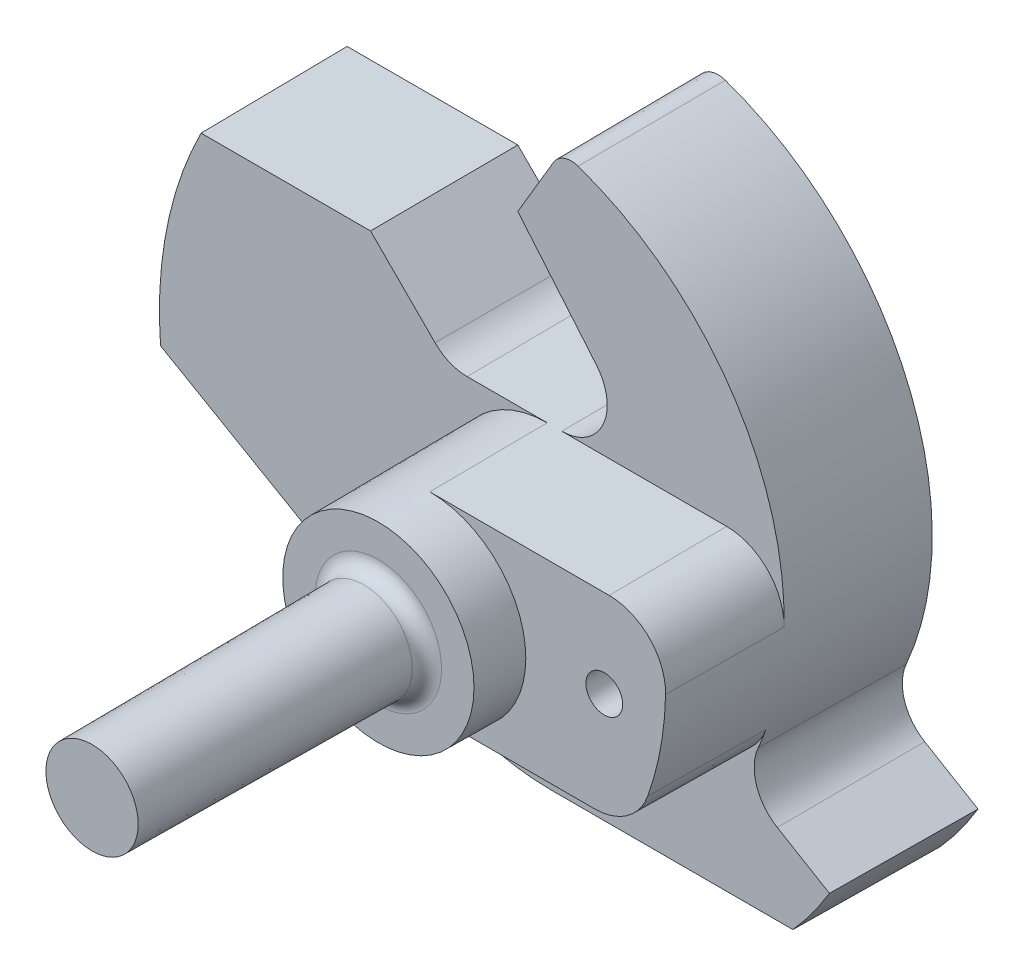
from build123d import *

# Parameters (mm, degrees)
EXTRUDE1_DEPTH      = 2.54
SKETCH2_R           = 1.7018
EXTRUDE2_DEPTH      = 2.921
EXTRUDE5_DEPTH      = 2.032
SKETCH3_R           = 0.889
EXTRUDE3_DEPTH      = 4.953
EXTRUDE4_DEPTH      = 4.819904
CIRPATTERN1_COUNT   = 8
EXTRUDE13_DEPTH     = 4.819904
SKETCH7_R           = 0.3175
EXTRUDE6_DEPTH      = 11.651707
EXTRUDE10_DEPTH     = 2.54
EXTRUDE12_DEPTH     = 1.27
DRAFT5_ANGLE        = 1
DRAFT6_ANGLE        = 1
DRAFT7_ANGLE        = -0.5
FILLET1_R           = 0.254
CHAMFER1_SIZE       = 0.381
CHAMFER1_SIZE2      = 0.659911
EXTRUDE14_DEPTH     = 0.6604
BOSS_EXTRUDE1_DEPTH = 4.159504
CUT_EXTRUDE1_DEPTH  = 1.5
CHAMFER3_SIZE       = 0.1016
CHAMFER4_SIZE       = 0.3048


with BuildPart() as part:
    # Sketch1 → Extrude1 (new body)
    with BuildSketch(Plane.XY):
        with BuildLine():
            Line((-1.924985, 1.924985), (-3.048, 3.048))
            Line((-3.048, 3.048), (-6.001338, 3.048))
            ThreePointArc((-6.001338, 3.048), (-6.602226, 1.310331), (-6.710486, -0.525108))
            Line((-6.710486, -0.525108), (-1.963941, -3.265527))
            ThreePointArc((-1.963941, -3.265527), (-0.983782, -3.671523), (0.068059, -3.81))
            Line((0.068059, -3.81), (4.259709, -3.81))
            ThreePointArc((4.259709, -3.81), (4.60741, -3.381272), (4.912126, -2.921))
            Line((4.912126, -2.921), (3.99071, -2.373079))
            ThreePointArc((3.99071, -2.373079), (3.640517, -1.933065), (3.66974, -1.371466))
            ThreePointArc((3.66974, -1.371466), (3.67694, 2.904446), (0.541494, 5.811758))
            ThreePointArc((0.541494, 5.811758), (0.285086, 5.809719), (0.088038, 5.645641))
            Line((0.088038, 5.645641), (-0.535349, 4.589543))
            Line((-0.535349, 4.589543), (0.837366, 2.953604))
            ThreePointArc((0.837366, 2.953604), (0.944247, 2.141765), (0.25364, 1.7018))
            Line((0.25364, 1.7018), (-1.386169, 1.7018))
            ThreePointArc((-1.386169, 1.7018), (-1.677774, 1.759804), (-1.924985, 1.924985))
        make_face()
    extrude(amount=EXTRUDE1_DEPTH)

    # Sketch2 → Extrude2 (add)
    with BuildSketch(Plane.XY.offset(2.54)):
        with Locations(Location((0, 0, 0), (0, 0, 90))):
            Circle(SKETCH2_R)
    extrude(amount=EXTRUDE2_DEPTH)

    # Sketch6 → Extrude5 (add)
    with BuildSketch(Plane.XY.offset(2.54)):
        with BuildLine():
            Line((0, 1.7018), (3.103645, 1.7018))
            ThreePointArc((3.103645, 1.7018), (3.829425, 1.396785), (4.119429, 0.664878))
            ThreePointArc((4.119429, 0.664878), (4.031669, -0.195019), (3.806175, -1.029451))
            ThreePointArc((3.806175, -1.029451), (3.434483, -1.516885), (2.850058, -1.7018))
            Line((2.850058, -1.7018), (0, -1.7018))
            ThreePointArc((0, -1.7018), (1.7018, 0), (0, 1.7018))
        make_face()
    extrude(amount=EXTRUDE5_DEPTH)

    # Sketch3 → Extrude3 (add)
    with BuildSketch(Plane.XY.offset(5.461)):
        Circle(SKETCH3_R)
    extrude(amount=EXTRUDE3_DEPTH)

    # Sketch4 → Extrude4 (cut)
    with BuildSketch(Plane(origin=(0, 0, 0), x_dir=(-1, 0, 0), z_dir=(0, 0, -1))):
        with BuildLine():
            Line((0, 0), (-0.311045, 0.750929))
            ThreePointArc((-0.311045, 0.750929), (-0.238333, 0.777072), (-0.163468, 0.796192))
            ThreePointArc((-0.163468, 0.796192), (0, 0.7366), (0.163468, 0.796192))
            ThreePointArc((0.163468, 0.796192), (0.238333, 0.777072), (0.311045, 0.750929))
            Line((0.311045, 0.750929), (0, 0))
        make_face()
    extrude4 = extrude(amount=-EXTRUDE4_DEPTH, mode=Mode.SUBTRACT)

    # CirPattern1: Extrude4 ×8 about axis
    cirpattern1_axis = Axis((0, 0, 0), (0, 0, 1))
    for i in range(1, CIRPATTERN1_COUNT):
        add(extrude4.rotate(cirpattern1_axis, i * 360 / CIRPATTERN1_COUNT), mode=Mode.SUBTRACT)

    # Sketch14 → Extrude13 (add)
    with BuildSketch(Plane(origin=(0, 0, 0), x_dir=(-1, 0, 0), z_dir=(0, 0, -1))):
        with BuildLine():
            Line((-0.730885, 0.3556), (0.730885, 0.3556))
            ThreePointArc((0.730885, 0.3556), (0, 0.8128), (-0.730885, 0.3556))
        make_face()
    extrude(amount=-EXTRUDE13_DEPTH)

    # Sketch7 → Extrude6 (cut, through all)
    with BuildSketch(Plane.XY.offset(4.572)):
        with Locations((3.019144, 0.144507)):
            Circle(SKETCH7_R)
    extrude(amount=-EXTRUDE6_DEPTH, mode=Mode.SUBTRACT)

    # Sketch11 → Extrude10 (cut)
    with BuildSketch(Plane(origin=(0, 0, 0), x_dir=(-1, 0, 0), z_dir=(0, 0, -1))):
        with BuildLine():
            ThreePointArc((-2.983619, -0.648448), (-2.234049, 0.261404), (-3.216173, 0.913414))
            ThreePointArc((-3.216173, 0.913414), (-3.503818, 0.716068), (-3.59637, 0.379737))
            ThreePointArc((-3.59637, 0.379737), (-3.559938, 0.063985), (-3.502801, -0.248683))
            ThreePointArc((-3.502801, -0.248683), (-3.316279, -0.543462), (-2.983619, -0.648448))
        make_face()
    extrude(amount=-EXTRUDE10_DEPTH, mode=Mode.SUBTRACT)

    # Sketch13 → Extrude12 (cut)
    with BuildSketch(Plane(origin=(0, 0, 0), x_dir=(-1, 0, 0), z_dir=(0, 0, -1))):
        with BuildLine():
            Line((2.93074, -1.240876), (5.181827, 0.05879))
            ThreePointArc((5.181827, 0.05879), (5.380013, 0.267231), (5.433245, 0.549882))
            ThreePointArc((5.433245, 0.549882), (5.372687, 0.978137), (5.278428, 1.400256))
            ThreePointArc((5.278428, 1.400256), (5.097164, 1.672638), (4.787412, 1.778))
            Line((4.787412, 1.778), (3.784472, 1.778))
            ThreePointArc((3.784472, 1.778), (3.590069, 1.739331), (3.425261, 1.62921))
            Line((3.425261, 1.62921), (2.82301, 1.026959))
            ThreePointArc((2.82301, 1.026959), (2.666482, 0.885883), (2.496186, 0.761776))
            ThreePointArc((2.496186, 0.761776), (2.313241, 0.550864), (2.269383, 0.27513))
            ThreePointArc((2.269383, 0.27513), (2.277738, -0.194184), (2.19006, -0.65531))
            ThreePointArc((2.19006, -0.65531), (2.36169, -1.199441), (2.93074, -1.240876))
        make_face()
    extrude(amount=-EXTRUDE12_DEPTH, mode=Mode.SUBTRACT)

    # Draft5
    draft5_faces = [part.faces().sort_by_distance(p)[0] for p in [
        (3.316279, -0.543462, 1.27),
        (3.559938, 0.063985, 1.27),
        (3.503818, 0.716068, 1.27),
        (2.234049, 0.261404, 1.27),
    ]]
    draft(draft5_faces, Plane(origin=(0.896458, 0.316881, 2.54), x_dir=(-1, 0, 0), z_dir=(0, 0, -1)), DRAFT5_ANGLE)

    # Draft6
    draft6_faces = [part.faces().sort_by_distance(p)[0] for p in [
        (-2.666482, 0.885883, 0.635),
        (-2.313241, 0.550864, 0.635),
        (-2.277738, -0.194184, 0.635),
        (-2.36169, -1.199441, 0.635),
        (-4.056284, -0.591043, 0.635),
        (-5.380013, 0.267231, 0.635),
        (-5.372687, 0.978137, 0.635),
        (-5.097164, 1.672638, 0.635),
        (-4.285942, 1.778, 0.635),
        (-3.590069, 1.739331, 0.635),
        (-3.124136, 1.328085, 0.635),
    ]]
    draft(draft6_faces, Plane(origin=(0, 0, 1.27), x_dir=(-1, 0, 0), z_dir=(0, 0, -1)), DRAFT6_ANGLE)

    # Draft7
    draft7_faces = [part.faces().sort_by_distance(p)[0] for p in [
        (-0.889, 0, 7.9375),
        (0, -1.7018, 4.0005),
        (1.425029, -1.7018, 3.556),
        (4.60741, -3.381272, 1.27),
        (2.163884, -3.81, 1.27),
        (-0.983782, -3.671523, 1.27),
        (-4.337213, -1.895318, 1.27),
        (-6.602226, 1.310331, 1.27),
        (-4.524669, 3.048, 1.27),
        (-2.486492, 2.486492, 1.27),
        (-1.677774, 1.759804, 1.27),
        (0.285086, 5.809719, 1.27),
        (-0.223656, 5.117592, 1.27),
        (0.151008, 3.771574, 1.27),
        (0.944247, 2.141765, 1.27),
        (0.709356, 1.7018, 2.646746),
        (3.829425, 1.396785, 3.556),
        (3.434483, -1.516885, 3.556),
        (4.451418, -2.647039, 1.27),
        (3.640517, -1.933065, 1.27),
        (3.67694, 2.904446, 2.286),
    ]]
    draft(draft7_faces, Plane(origin=(0, 0, 0), x_dir=(-1, 0, 0), z_dir=(0, 0, -1)), DRAFT7_ANGLE)

    # Fillet1
    fillet1_edges = [part.edges().sort_by_distance(p)[0] for p in [
        (-0.841343, 0, 5.461),
    ]]
    fillet(fillet1_edges, radius=FILLET1_R)

    # Chamfer1
    chamfer1_edges = [part.edges().sort_by_distance(p)[0] for p in [
        (0, 0.3556, 0),
    ]]
    chamfer1_side = [part.faces().sort_by_distance(p)[0] for p in [
        (0.337088, 5.667766, 0),
    ]]
    chamfer(chamfer1_edges, length=CHAMFER1_SIZE, length2=CHAMFER1_SIZE2, reference=chamfer1_side[0])

    # Sketch16 → Extrude14 (cut)
    with BuildSketch(Plane(origin=(0, 0, 0), x_dir=(-1, 0, 0), z_dir=(0, 0, -1))):
        with BuildLine():
            Line((0.730885, 0.3556), (-0.730885, 0.3556))
            ThreePointArc((-0.730885, 0.3556), (0, -0.8128), (0.730885, 0.3556))
        make_face()
    extrude(amount=-EXTRUDE14_DEPTH, mode=Mode.SUBTRACT)

    # Sketch17 → Boss-Extrude1 (add)
    with BuildSketch(Plane(origin=(0, 0, 0.6604), x_dir=(-1, 0, 0), z_dir=(0, 0, -1))):
        with BuildLine():
            Line((0.730885, 0.3556), (0.64508, 0.3556))
            ThreePointArc((0.64508, 0.3556), (0, -0.7366), (-0.64508, 0.3556))
            Line((-0.64508, 0.3556), (-0.730885, 0.3556))
            ThreePointArc((-0.730885, 0.3556), (0, -0.8128), (0.730885, 0.3556))
        make_face()
    extrude(amount=-BOSS_EXTRUDE1_DEPTH)

    # Sketch18 → Cut-Extrude1 (cut)
    with BuildSketch(Plane(origin=(0, 0, 0), x_dir=(-1, 0, 0), z_dir=(0, 0, -1))):
        with BuildLine():
            Line((0.730885, 0.3556), (-0.730885, 0.3556))
            ThreePointArc((-0.730885, 0.3556), (0, -0.8128), (0.730885, 0.3556))
        make_face()
    extrude(amount=-CUT_EXTRUDE1_DEPTH, mode=Mode.SUBTRACT)

    # Chamfer3
    # the kernel refuses this chamfer: 0.1016 mm, written as the material it takes off along each edge
    with BuildSketch(Plane(origin=(0, 0, 1.5), x_dir=(0.6528066394182584, 0.7575245814700933, 0), z_dir=(-0.7575245814700933, 0.6528066394182584, 0))) as chamfer3_piece_1_section:
        Polygon((0.7366, -CHAMFER3_SIZE), (0.7366 + CHAMFER3_SIZE, 0), (0.7366, 0), align=None)
    chamfer3_piece_1 = revolve(axis=Axis((0, 0, 1.5), (0, 0, -1)), revolution_arc=278.492908, mode=Mode.PRIVATE)
    chamfer3_piece_1 = split(chamfer3_piece_1, bisect_by=Plane(origin=(0, 0.3556, 1.563136), z_dir=(0, -1, 0)), keep=Keep.TOP, mode=Mode.PRIVATE)
    chamfer3_piece_1 = chamfer3_piece_1 & Plane(origin=(0, 0, 1.563136), x_dir=(0.9795673076923074, 0.20111660722189145, 0), z_dir=(0, 0, -1)) * Cylinder(0.8128, 4, mode=Mode.PRIVATE)
    add(chamfer3_piece_1, mode=Mode.SUBTRACT)

    # Chamfer4
    chamfer4_edges = [part.edges().sort_by_distance(p)[0] for p in [
        (0, -0.8128, 0),
    ]]
    chamfer(chamfer4_edges, length=CHAMFER4_SIZE)


solid = part.part
